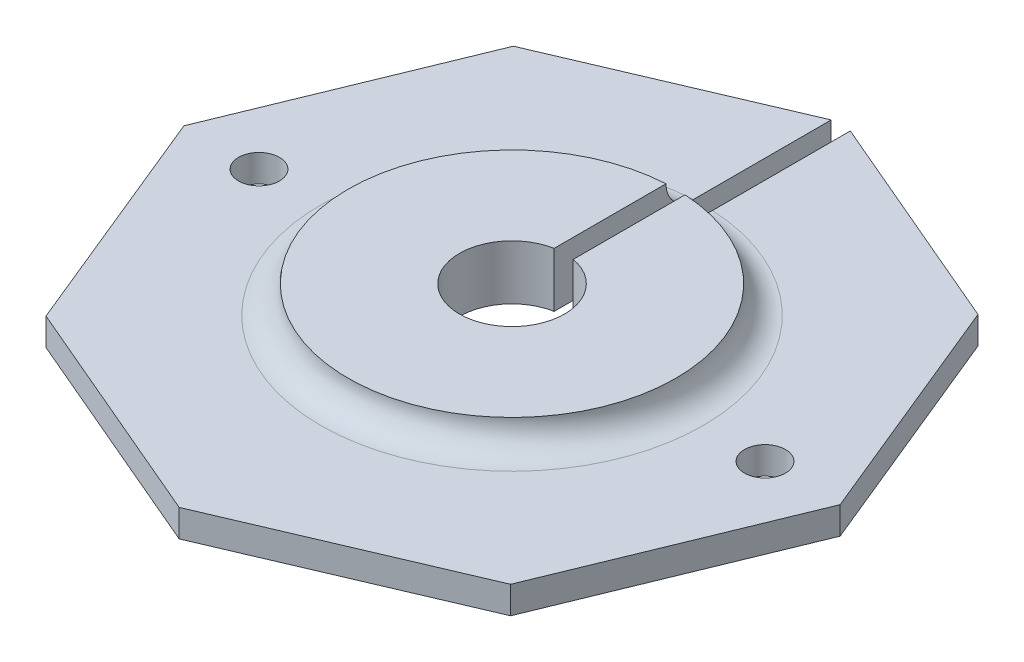
from build123d import *

# Parameters (mm, degrees)
BOSS_EXTRUDE1_DEPTH = 2
SKETCH2_R           = 12
BOSS_EXTRUDE2_DEPTH = 2
SKETCH3_R           = 3.85
CUT_EXTRUDE1_DEPTH  = 25
CUT_EXTRUDE2_DEPTH  = 35.465615693
FILLET2_R           = 2
SKETCH6_R           = 1.5
CUT_EXTRUDE3_DEPTH  = 35.29108726


with BuildPart() as part:
    # Sketch1 → Boss-Extrude1 (new body)
    with BuildSketch(Plane(origin=(0, 0, 0), x_dir=(1, 0, 0), z_dir=(0, 1, 0))):
        Polygon((0, 24.378752643), (-17.015462305, 17.117620324), (-24.03237576, 0), (-17.015462305, -17.117620324), (0, -24.378752643), (17.015462305, -17.117620324), (24.03237576, 0), (17.015462305, 17.117620324), align=None)
    extrude(amount=BOSS_EXTRUDE1_DEPTH)

    # Sketch2 → Boss-Extrude2 (add)
    with BuildSketch(Plane(origin=(0, 2, 0), x_dir=(1, 0, 0), z_dir=(0, 1, 0))):
        with Locations(Location((0, 0, 0), (0, 0, 270))):
            Circle(SKETCH2_R)
    extrude(amount=BOSS_EXTRUDE2_DEPTH)

    # Sketch3 → Cut-Extrude1 (cut)
    with BuildSketch(Plane(origin=(0, 4, 0), x_dir=(1, 0, 0), z_dir=(0, 1, 0))):
        with Locations(Location((0, 0, 0), (0, 0, 270))):
            Circle(SKETCH3_R)
    extrude(amount=-CUT_EXTRUDE1_DEPTH, mode=Mode.SUBTRACT)

    # Sketch4 → Cut-Extrude2 (cut, through all)
    with BuildSketch(Plane(origin=(0, 4, 0), x_dir=(1, 0, 0), z_dir=(0, 1, 0))):
        Polygon((0.7, 0), (0.7, 24.080036538), (0, 24.378752643), (-0.7, 24.080036538), (-0.7, 0), align=None)
    extrude(amount=-CUT_EXTRUDE2_DEPTH, mode=Mode.SUBTRACT)

    # Fillet2
    fillet2_edges = [part.edges().sort_by_distance(p)[0] for p in [
        (-11.994890396, 2, 0.350149094),
    ]]
    fillet(fillet2_edges, radius=FILLET2_R - 0.0001)  # a hair under: the kernel refuses the full size

    # Sketch6 → Cut-Extrude3 (cut, through all)
    with BuildSketch(Plane(origin=(0, 2, 0), x_dir=(1, 0, 0), z_dir=(0, 1, 0))):
        with Locations(Location((-18.53237576, 0, 0), (0, 0, 270))):
            Circle(SKETCH6_R)
        with Locations(Location((18.53237576, 0, 0), (0, 0, 270))):
            Circle(SKETCH6_R)
    extrude(amount=-CUT_EXTRUDE3_DEPTH, mode=Mode.SUBTRACT)


solid = part.part
